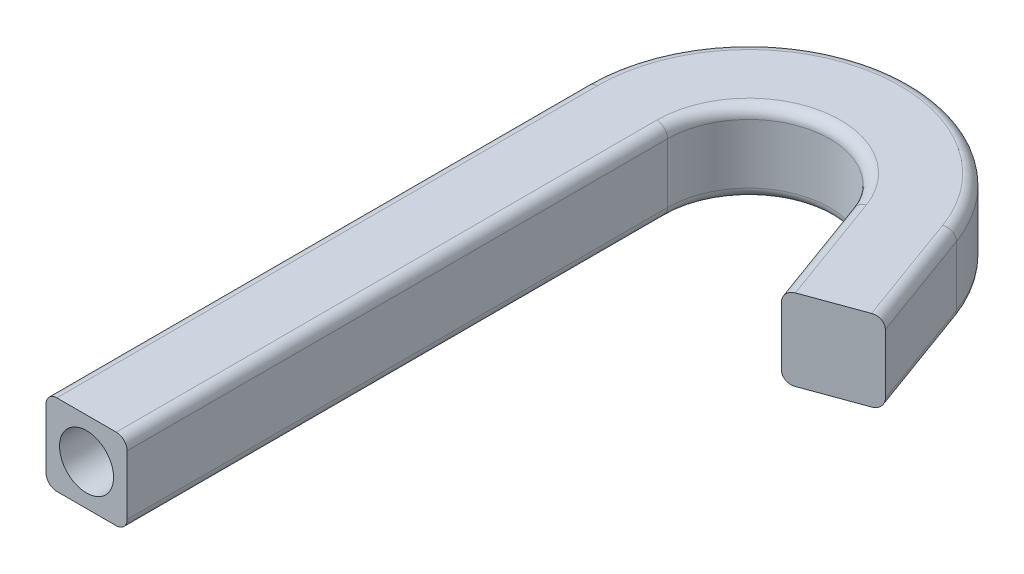
from build123d import *

# Parameters (mm, degrees)
BOSS_EXTRUDE1_DEPTH = 19.05
SKETCH9_R           = 6.35
CUT_EXTRUDE2_DEPTH  = 34.29
FILLET1_R           = 2.54


with BuildPart() as part:
    # Sketch1 → Boss-Extrude1 (new body)
    with BuildSketch(Plane(origin=(0, 0, 0), x_dir=(1, 0, 0), z_dir=(0, 1, 0))):
        with BuildLine():
            Line((27.462285602, -19.753535756), (45.363430028, -13.238052025))
            Line((45.363430028, -13.238052025), (35.802288852, 13.030967461))
            ThreePointArc((35.802288852, 13.030967461), (-6.615995569, 37.52117539), (-38.1, 0))
            Line((-38.1, 0), (-38.1, -127))
            Line((-38.1, -127), (-19.05, -127))
            Line((-19.05, -127), (-19.05, 0))
            ThreePointArc((-19.05, 0), (-3.307997785, 18.760587695), (17.901144426, 6.51548373))
            Line((17.901144426, 6.51548373), (27.462285602, -19.753535756))
        make_face()
    extrude(amount=BOSS_EXTRUDE1_DEPTH)

    # Sketch9 → Cut-Extrude2 (cut)
    with BuildSketch(Plane.XY.offset(127)):
        with Locations((-28.575, 9.525)):
            Circle(SKETCH9_R)
    extrude(amount=-CUT_EXTRUDE2_DEPTH, mode=Mode.SUBTRACT)

    # Fillet1
    fillet1_edges = [part.edges().sort_by_distance(p)[0] for p in [
        (22.681715014, 19.05, 6.619026013),
        (-3.307997785, 19.05, -18.760587695),
        (22.681715014, 0, 6.619026013),
        (-3.307997785, 0, -18.760587695),
        (-19.05, 0, 63.5),
        (-19.05, 19.05, 63.5),
        (-38.1, 0, 63.5),
        (-6.615995569, 0, -37.52117539),
        (40.58285944, 0, 0.103542282),
        (40.58285944, 19.05, 0.103542282),
        (-6.615995569, 19.05, -37.52117539),
        (-38.1, 19.05, 63.5),
    ]]
    fillet(fillet1_edges, radius=FILLET1_R)


solid = part.part
